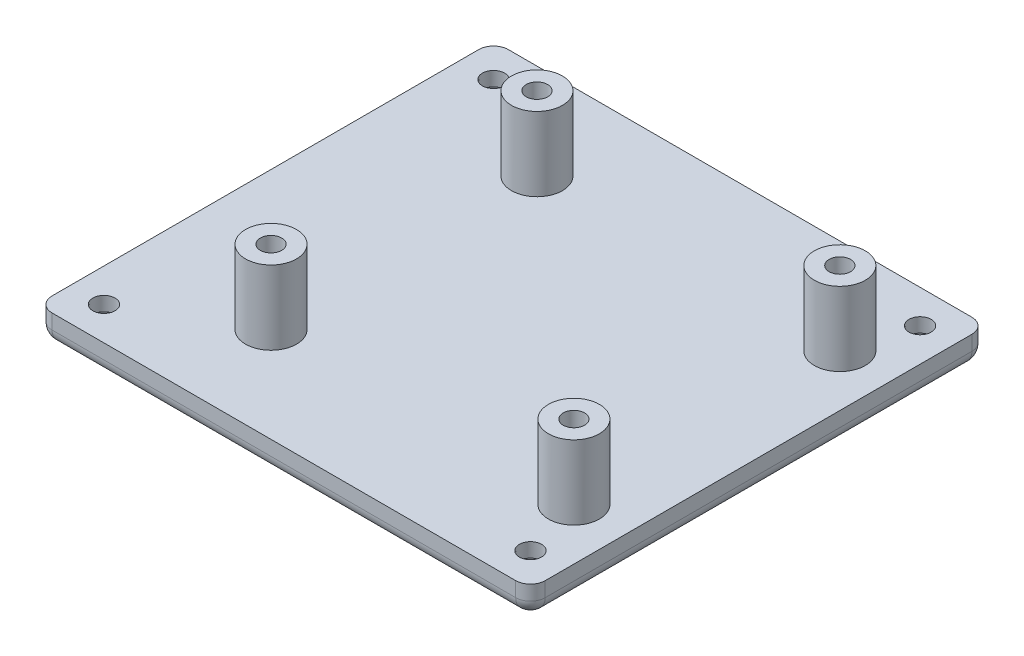
from build123d import *

# Parameters (mm, degrees)
SKETCH1_W                    = 66.76
SKETCH1_H                    = 61.76
BOSS_EXTRUDE3_DEPTH          = 4
SKETCH2_R                    = 3.45
SKETCH2_R_2                  = 1.45
BOSS_EXTRUDE4_DEPTH          = 10
SKETCH3_R                    = 1.5
CUT_EXTRUDE1_DEPTH           = 3
CUT_EXTRUDE1_DRAFT           = 3
CUT_EXTRUDE1_PROFILE_2_DEPTH = 3
CUT_EXTRUDE1_PROFILE_2_DRAFT = 3
CUT_EXTRUDE1_PROFILE_3_DEPTH = 3
CUT_EXTRUDE1_PROFILE_3_DRAFT = 3
CUT_EXTRUDE1_PROFILE_4_DEPTH = 3
CUT_EXTRUDE1_PROFILE_4_DRAFT = 3
FILLET2_R                    = 2
FILLET1_R                    = 2
SKETCH5_R                    = 3
CUT_EXTRUDE2_DEPTH           = 2
CUT_EXTRUDE2_DRAFT           = -1
CUT_EXTRUDE2_PROFILE_2_DEPTH = 2
CUT_EXTRUDE2_PROFILE_2_DRAFT = -1
CUT_EXTRUDE2_PROFILE_3_DEPTH = 2
CUT_EXTRUDE2_PROFILE_3_DRAFT = -1
CUT_EXTRUDE2_PROFILE_4_DEPTH = 2
CUT_EXTRUDE2_PROFILE_4_DRAFT = -1


with BuildPart() as part:
    # Sketch1 → Boss-Extrude3 (new body)
    with BuildSketch(Plane(origin=(0, 0, 0), x_dir=(1, 0, 0), z_dir=(0, 1, 0))):
        with Locations((33.38, 30.88)):
            Rectangle(SKETCH1_W, SKETCH1_H)
    extrude(amount=-BOSS_EXTRUDE3_DEPTH)

    # Sketch2 → Boss-Extrude4 (add)
    # profile 1 of 4: a face of its own
    with BuildSketch(Plane(origin=(0, 0, 0), x_dir=(1, 0, 0), z_dir=(0, 1, 0))):
        with Locations((59.76, 12.88)):
            Circle(SKETCH2_R)
        with Locations((59.76, 12.88)):
            Circle(SKETCH2_R_2, mode=Mode.SUBTRACT)
    # profile 2 of 4: a face of its own
    with BuildSketch(Plane(origin=(0, 0, 0), x_dir=(1, 0, 0), z_dir=(0, 1, 0))):
        with Locations((18.76, 12.88)):
            Circle(SKETCH2_R)
        with Locations((18.76, 12.88)):
            Circle(SKETCH2_R_2, mode=Mode.SUBTRACT)
    # profile 3 of 4: a face of its own
    with BuildSketch(Plane(origin=(0, 0, 0), x_dir=(1, 0, 0), z_dir=(0, 1, 0))):
        with Locations((59.76, 48.88)):
            Circle(SKETCH2_R)
        with Locations((59.76, 48.88)):
            Circle(SKETCH2_R_2, mode=Mode.SUBTRACT)
    # profile 4 of 4: a face of its own
    with BuildSketch(Plane(origin=(0, 0, 0), x_dir=(1, 0, 0), z_dir=(0, 1, 0))):
        with Locations((18.76, 48.88)):
            Circle(SKETCH2_R)
        with Locations((18.76, 48.88)):
            Circle(SKETCH2_R_2, mode=Mode.SUBTRACT)
    extrude(amount=BOSS_EXTRUDE4_DEPTH)


with BuildPart() as cut_extrude1_tool:
    # Sketch3 → Cut-Extrude1 (with draft: the straight prism first)
    with BuildSketch(Plane(origin=(0, 0, 0), x_dir=(1, 0, 0), z_dir=(0, 1, 0))):
        with Locations((4.51, 57.25)):
            Circle(SKETCH3_R)
    extrude(amount=-CUT_EXTRUDE1_DEPTH)
    # Cut-Extrude1: the draft: its side faces are tilted about the plane it starts from
    cut_extrude1_sides = [cut_extrude1_tool.faces().sort_by_distance(p)[0] for p in [
        (3.01, -1.5, -57.25),
    ]]
    draft(cut_extrude1_sides, Plane(origin=(0, 0, 0), x_dir=(1, 0, 0), z_dir=(0, 1, 0)), CUT_EXTRUDE1_DRAFT)


with BuildPart() as part_1:
    add(part.part)

    # Cut-Extrude1: cut by cut_extrude1_tool
    add(cut_extrude1_tool.part, mode=Mode.SUBTRACT)


with BuildPart() as cut_extrude1_profile_2_tool:
    # Sketch3 → Cut-Extrude1 profile 2 (with draft: the straight prism first)
    with BuildSketch(Plane(origin=(0, 0, 0), x_dir=(1, 0, 0), z_dir=(0, 1, 0))):
        with Locations((62.25, 57.25)):
            Circle(SKETCH3_R)
    extrude(amount=-CUT_EXTRUDE1_PROFILE_2_DEPTH)
    # Cut-Extrude1 profile 2: the draft: its side faces are tilted about the plane it starts from
    cut_extrude1_profile_2_sides = [cut_extrude1_profile_2_tool.faces().sort_by_distance(p)[0] for p in [
        (60.75, -1.5, -57.25),
    ]]
    draft(cut_extrude1_profile_2_sides, Plane(origin=(0, 0, 0), x_dir=(1, 0, 0), z_dir=(0, 1, 0)), CUT_EXTRUDE1_PROFILE_2_DRAFT)


with BuildPart() as part_2:
    add(part_1.part)

    # Cut-Extrude1 profile 2: cut by cut_extrude1_profile_2_tool
    add(cut_extrude1_profile_2_tool.part, mode=Mode.SUBTRACT)


with BuildPart() as cut_extrude1_profile_3_tool:
    # Sketch3 → Cut-Extrude1 profile 3 (with draft: the straight prism first)
    with BuildSketch(Plane(origin=(0, 0, 0), x_dir=(1, 0, 0), z_dir=(0, 1, 0))):
        with Locations((62.25, 4.51)):
            Circle(SKETCH3_R)
    extrude(amount=-CUT_EXTRUDE1_PROFILE_3_DEPTH)
    # Cut-Extrude1 profile 3: the draft: its side faces are tilted about the plane it starts from
    cut_extrude1_profile_3_sides = [cut_extrude1_profile_3_tool.faces().sort_by_distance(p)[0] for p in [
        (60.75, -1.5, -4.51),
    ]]
    draft(cut_extrude1_profile_3_sides, Plane(origin=(0, 0, 0), x_dir=(1, 0, 0), z_dir=(0, 1, 0)), CUT_EXTRUDE1_PROFILE_3_DRAFT)


with BuildPart() as part_3:
    add(part_2.part)

    # Cut-Extrude1 profile 3: cut by cut_extrude1_profile_3_tool
    add(cut_extrude1_profile_3_tool.part, mode=Mode.SUBTRACT)


with BuildPart() as cut_extrude1_profile_4_tool:
    # Sketch3 → Cut-Extrude1 profile 4 (with draft: the straight prism first)
    with BuildSketch(Plane(origin=(0, 0, 0), x_dir=(1, 0, 0), z_dir=(0, 1, 0))):
        with Locations((4.51, 4.51)):
            Circle(SKETCH3_R)
    extrude(amount=-CUT_EXTRUDE1_PROFILE_4_DEPTH)
    # Cut-Extrude1 profile 4: the draft: its side faces are tilted about the plane it starts from
    cut_extrude1_profile_4_sides = [cut_extrude1_profile_4_tool.faces().sort_by_distance(p)[0] for p in [
        (3.01, -1.5, -4.51),
    ]]
    draft(cut_extrude1_profile_4_sides, Plane(origin=(0, 0, 0), x_dir=(1, 0, 0), z_dir=(0, 1, 0)), CUT_EXTRUDE1_PROFILE_4_DRAFT)


with BuildPart() as part_4:
    add(part_3.part)

    # Cut-Extrude1 profile 4: cut by cut_extrude1_profile_4_tool
    add(cut_extrude1_profile_4_tool.part, mode=Mode.SUBTRACT)

    # Fillet2
    fillet2_edges = [part_4.edges().sort_by_distance(p)[0] for p in [
        (0, -2, 0),
        (66.76, -2, 0),
        (66.76, -2, -61.76),
        (0, -2, -61.76),
    ]]
    fillet(fillet2_edges, radius=FILLET2_R)

    # Fillet1
    fillet1_edges = [part_4.edges().sort_by_distance(p)[0] for p in [
        (66.76, -4, -30.88),
        (33.38, -4, -61.76),
        (0, -4, -30.88),
        (33.38, -4, 0),
        (0.585786438, -4, -0.585786438),
        (0.585786438, -4, -61.174213562),
        (66.174213562, -4, -61.174213562),
        (66.174213562, -4, -0.585786438),
    ]]
    fillet(fillet1_edges, radius=FILLET1_R)


with BuildPart() as cut_extrude2_tool:
    # Sketch5 → Cut-Extrude2 (with draft: the straight prism first)
    with BuildSketch(Plane.XZ.offset(4)):
        with Locations((4.51, -4.51)):
            Circle(SKETCH5_R)
    extrude(amount=-CUT_EXTRUDE2_DEPTH)
    # Cut-Extrude2: the draft: its side faces are tilted about the plane it starts from
    cut_extrude2_sides = [cut_extrude2_tool.faces().sort_by_distance(p)[0] for p in [
        (1.51, -3, -4.51),
    ]]
    draft(cut_extrude2_sides, Plane.XZ.offset(4), CUT_EXTRUDE2_DRAFT)


with BuildPart() as part_5:
    add(part_4.part)

    # Cut-Extrude2: cut by cut_extrude2_tool
    add(cut_extrude2_tool.part, mode=Mode.SUBTRACT)


with BuildPart() as cut_extrude2_profile_2_tool:
    # Sketch5 → Cut-Extrude2 profile 2 (with draft: the straight prism first)
    with BuildSketch(Plane.XZ.offset(4)):
        with Locations((62.25, -4.51)):
            Circle(SKETCH5_R)
    extrude(amount=-CUT_EXTRUDE2_PROFILE_2_DEPTH)
    # Cut-Extrude2 profile 2: the draft: its side faces are tilted about the plane it starts from
    cut_extrude2_profile_2_sides = [cut_extrude2_profile_2_tool.faces().sort_by_distance(p)[0] for p in [
        (59.25, -3, -4.51),
    ]]
    draft(cut_extrude2_profile_2_sides, Plane.XZ.offset(4), CUT_EXTRUDE2_PROFILE_2_DRAFT)


with BuildPart() as part_6:
    add(part_5.part)

    # Cut-Extrude2 profile 2: cut by cut_extrude2_profile_2_tool
    add(cut_extrude2_profile_2_tool.part, mode=Mode.SUBTRACT)


with BuildPart() as cut_extrude2_profile_3_tool:
    # Sketch5 → Cut-Extrude2 profile 3 (with draft: the straight prism first)
    with BuildSketch(Plane.XZ.offset(4)):
        with Locations((62.25, -57.25)):
            Circle(SKETCH5_R)
    extrude(amount=-CUT_EXTRUDE2_PROFILE_3_DEPTH)
    # Cut-Extrude2 profile 3: the draft: its side faces are tilted about the plane it starts from
    cut_extrude2_profile_3_sides = [cut_extrude2_profile_3_tool.faces().sort_by_distance(p)[0] for p in [
        (59.25, -3, -57.25),
    ]]
    draft(cut_extrude2_profile_3_sides, Plane.XZ.offset(4), CUT_EXTRUDE2_PROFILE_3_DRAFT)


with BuildPart() as part_7:
    add(part_6.part)

    # Cut-Extrude2 profile 3: cut by cut_extrude2_profile_3_tool
    add(cut_extrude2_profile_3_tool.part, mode=Mode.SUBTRACT)


with BuildPart() as cut_extrude2_profile_4_tool:
    # Sketch5 → Cut-Extrude2 profile 4 (with draft: the straight prism first)
    with BuildSketch(Plane.XZ.offset(4)):
        with Locations((4.51, -57.25)):
            Circle(SKETCH5_R)
    extrude(amount=-CUT_EXTRUDE2_PROFILE_4_DEPTH)
    # Cut-Extrude2 profile 4: the draft: its side faces are tilted about the plane it starts from
    cut_extrude2_profile_4_sides = [cut_extrude2_profile_4_tool.faces().sort_by_distance(p)[0] for p in [
        (1.51, -3, -57.25),
    ]]
    draft(cut_extrude2_profile_4_sides, Plane.XZ.offset(4), CUT_EXTRUDE2_PROFILE_4_DRAFT)


with BuildPart() as part_8:
    add(part_7.part)

    # Cut-Extrude2 profile 4: cut by cut_extrude2_profile_4_tool
    add(cut_extrude2_profile_4_tool.part, mode=Mode.SUBTRACT)


solid = part_8.part
